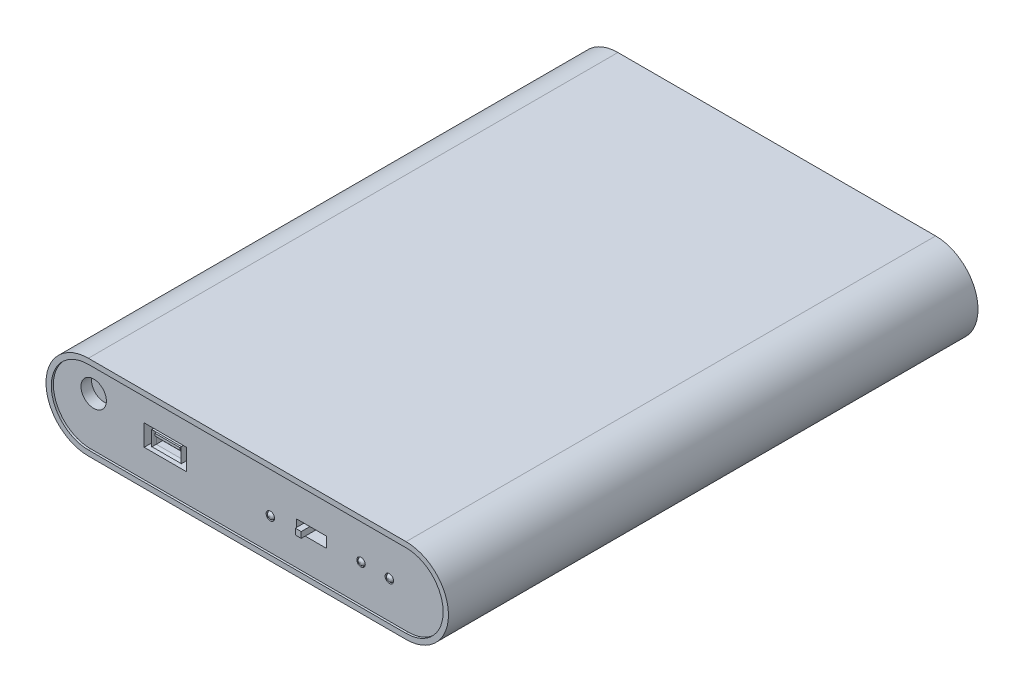
from build123d import *

# Parameters (mm, degrees)
EXTRUDE_1_DEPTH     = 250
SKETCH_2_R          = 4
CUT_EXTRUDE_1_DEPTH = 5
SKETCH_3_R          = 6
SKETCH_3_R_2        = 5.8
CUT_EXTRUDE_2_DEPTH = 5
FILLET_1_R          = 0.5
SKETCH_4_R          = 6
CUT_EXTRUDE_3_DEPTH = 1
CUT_EXTRUDE_START   = -1
CUT_EXTRUDE_4_DEPTH = 1
SKETCH_6_R          = 6
SKETCH_6_R_2        = 2
SKETCH_6_W          = 20
SKETCH_6_H          = 10
SKETCH_6_W_2        = 14
SKETCH_6_H_2        = 5
CUT_EXTRUDE_5_DEPTH = 5
SKETCH_7_R          = 1.8
EXTRUDE_2_DEPTH     = 5.5
FILLET_2_R          = 1.5
SKETCH_8_W          = 2.8
SKETCH_8_H          = 2.8
EXTRUDE_3_DEPTH     = 8
SKETCH_9_W          = 5
SKETCH_9_H          = 2.8
EXTRUDE_4_DEPTH     = 1
SKETCH_10_W         = 14
SKETCH_10_H         = 7
SKETCH_10_W_2       = 12.5
SKETCH_10_H_2       = 5.8
EXTRUDE_5_DEPTH     = 5
FILLET_3_R          = 2
SKETCH_11_W         = 12
SKETCH_11_H         = 1.131040785
EXTRUDE_6_DEPTH     = 4


with BuildPart() as part:
    # 草图1 → 凸台-拉伸1 (new body)
    with BuildSketch(Plane.XY):
        with BuildLine():
            Line((-75, 20), (75, 20))
            ThreePointArc((75, 20), (95, 0), (75, -20))
            Line((75, -20), (-75, -20))
            ThreePointArc((-75, -20), (-95, 0), (-75, 20))
        make_face()
    extrude(amount=EXTRUDE_1_DEPTH)

    # 草图2 → 切除-拉伸1 (cut)
    with BuildSketch(Plane(origin=(0, 0, 0), x_dir=(-1, 0, 0), z_dir=(0, 0, -1))):
        with Locations((24, -8)):
            Circle(SKETCH_2_R)
        with Locations((48, -8)):
            Circle(SKETCH_2_R)
        with Locations((0, -8)):
            Circle(SKETCH_2_R)
        with Locations((-24, -8)):
            Circle(SKETCH_2_R)
        with Locations((-48, -8)):
            Circle(SKETCH_2_R)
        with Locations((-48, 8)):
            Circle(SKETCH_2_R)
        with Locations((-24, 8)):
            Circle(SKETCH_2_R)
        with Locations((0, 8)):
            Circle(SKETCH_2_R)
        with Locations((24, 8)):
            Circle(SKETCH_2_R)
        with Locations((48, 8)):
            Circle(SKETCH_2_R)
    extrude(amount=-CUT_EXTRUDE_1_DEPTH, mode=Mode.SUBTRACT)

    # 草图3 → 切除-拉伸2 (cut)
    # profile 1 of 10: a face of its own
    with BuildSketch(Plane(origin=(0, 0, 0), x_dir=(-1, 0, 0), z_dir=(0, 0, -1))):
        with Locations((-48, -8)):
            Circle(SKETCH_3_R)
        with Locations((-48, -8)):
            Circle(SKETCH_3_R_2, mode=Mode.SUBTRACT)
    # profile 2 of 10: a face of its own
    with BuildSketch(Plane(origin=(0, 0, 0), x_dir=(-1, 0, 0), z_dir=(0, 0, -1))):
        with Locations((-24, -8)):
            Circle(SKETCH_3_R)
        with Locations((-24, -8)):
            Circle(SKETCH_3_R_2, mode=Mode.SUBTRACT)
    # profile 3 of 10: a face of its own
    with BuildSketch(Plane(origin=(0, 0, 0), x_dir=(-1, 0, 0), z_dir=(0, 0, -1))):
        with Locations((24, -8)):
            Circle(SKETCH_3_R)
        with Locations((24, -8)):
            Circle(SKETCH_3_R_2, mode=Mode.SUBTRACT)
    # profile 4 of 10: a face of its own
    with BuildSketch(Plane(origin=(0, 0, 0), x_dir=(-1, 0, 0), z_dir=(0, 0, -1))):
        with Locations((48, -8)):
            Circle(SKETCH_3_R)
        with Locations((48, -8)):
            Circle(SKETCH_3_R_2, mode=Mode.SUBTRACT)
    # profile 5 of 10: a face of its own
    with BuildSketch(Plane(origin=(0, 0, 0), x_dir=(-1, 0, 0), z_dir=(0, 0, -1))):
        with Locations((0, -8)):
            Circle(SKETCH_3_R)
        with Locations((0, -8)):
            Circle(SKETCH_3_R_2, mode=Mode.SUBTRACT)
    # profile 6 of 10: a face of its own
    with BuildSketch(Plane(origin=(0, 0, 0), x_dir=(-1, 0, 0), z_dir=(0, 0, -1))):
        with Locations((-48, 8)):
            Circle(SKETCH_3_R)
        with Locations((-48, 8)):
            Circle(SKETCH_3_R_2, mode=Mode.SUBTRACT)
    # profile 7 of 10: a face of its own
    with BuildSketch(Plane(origin=(0, 0, 0), x_dir=(-1, 0, 0), z_dir=(0, 0, -1))):
        with Locations((-24, 8)):
            Circle(SKETCH_3_R)
        with Locations((-24, 8)):
            Circle(SKETCH_3_R_2, mode=Mode.SUBTRACT)
    # profile 8 of 10: a face of its own
    with BuildSketch(Plane(origin=(0, 0, 0), x_dir=(-1, 0, 0), z_dir=(0, 0, -1))):
        with Locations((0, 8)):
            Circle(SKETCH_3_R)
        with Locations((0, 8)):
            Circle(SKETCH_3_R_2, mode=Mode.SUBTRACT)
    # profile 9 of 10: a face of its own
    with BuildSketch(Plane(origin=(0, 0, 0), x_dir=(-1, 0, 0), z_dir=(0, 0, -1))):
        with Locations((24, 8)):
            Circle(SKETCH_3_R)
        with Locations((24, 8)):
            Circle(SKETCH_3_R_2, mode=Mode.SUBTRACT)
    # profile 10 of 10: a face of its own
    with BuildSketch(Plane(origin=(0, 0, 0), x_dir=(-1, 0, 0), z_dir=(0, 0, -1))):
        with Locations((48, 8)):
            Circle(SKETCH_3_R)
        with Locations((48, 8)):
            Circle(SKETCH_3_R_2, mode=Mode.SUBTRACT)
    extrude(amount=-CUT_EXTRUDE_2_DEPTH, mode=Mode.SUBTRACT)

    # 圆角1
    fillet_1_edges = [part.edges().sort_by_distance(p)[0] for p in [
        (53.8, -8, 0),
        (-44, -8, 0),
        (4, -8, 0),
        (28, -8, 0),
        (52, -8, 0),
        (28, 8, 0),
        (52, 8, 0),
        (4, 8, 0),
        (-20, 8, 0),
        (-44, 8, 0),
        (-20, -8, 0),
        (5.8, -8, 0),
        (-42.2, -8, 0),
        (-18.2, -8, 0),
        (29.8, -8, 0),
        (53.8, 8, 0),
        (29.8, 8, 0),
        (5.8, 8, 0),
        (-18.2, 8, 0),
        (-42.2, 8, 0),
    ]]
    fillet(fillet_1_edges, radius=FILLET_1_R)

    # 草图4 → 切除-拉伸3 (cut)
    with BuildSketch(Plane(origin=(0, 0, 0), x_dir=(-1, 0, 0), z_dir=(0, 0, -1))):
        with BuildLine():
            Line((-75, -17.5), (75, -17.5))
            ThreePointArc((75, -17.5), (92.5, 0), (75, 17.5))
            Line((75, 17.5), (-75, 17.5))
            ThreePointArc((-75, 17.5), (-92.5, 0), (-75, -17.5))
        make_face()
        with Locations((-48, -8)):
            Circle(SKETCH_4_R, mode=Mode.SUBTRACT)
        with Locations((-24, -8)):
            Circle(SKETCH_4_R, mode=Mode.SUBTRACT)
        with Locations((0, -8)):
            Circle(SKETCH_4_R, mode=Mode.SUBTRACT)
        with Locations((48, -8)):
            Circle(SKETCH_4_R, mode=Mode.SUBTRACT)
        with Locations((24, -8)):
            Circle(SKETCH_4_R, mode=Mode.SUBTRACT)
        with Locations((-48, 8)):
            Circle(SKETCH_4_R, mode=Mode.SUBTRACT)
        with Locations((-24, 8)):
            Circle(SKETCH_4_R, mode=Mode.SUBTRACT)
        with Locations((0, 8)):
            Circle(SKETCH_4_R, mode=Mode.SUBTRACT)
        with Locations((24, 8)):
            Circle(SKETCH_4_R, mode=Mode.SUBTRACT)
        with Locations((48, 8)):
            Circle(SKETCH_4_R, mode=Mode.SUBTRACT)
    extrude(amount=-CUT_EXTRUDE_3_DEPTH, mode=Mode.SUBTRACT)

    # 草图5 → 切除-拉伸4 (cut)
    with BuildSketch(Plane.XY.offset(250).offset(CUT_EXTRUDE_START)):
        with BuildLine():
            Line((-75, -17.5), (75, -17.5))
            ThreePointArc((75, -17.5), (92.5, 0), (75, 17.5))
            Line((75, 17.5), (-75, 17.5))
            ThreePointArc((-75, 17.5), (-92.5, 0), (-75, -17.5))
        make_face()
    extrude(amount=CUT_EXTRUDE_4_DEPTH, mode=Mode.SUBTRACT)

    # 草图6 → 切除-拉伸5 (cut)
    with BuildSketch(Plane.XY.offset(249)):
        with Locations((-73.491317321, 5.761646119)):
            Circle(SKETCH_6_R)
        with Locations((52.725353747, -0.03600957)):
            Circle(SKETCH_6_R_2)
        with Locations((66.100916192, -0.03600957)):
            Circle(SKETCH_6_R_2)
        with Locations((9.923553925, -2.53600957)):
            Circle(SKETCH_6_R_2)
        with Locations((-39.658496965, 0.761646119)):
            Rectangle(SKETCH_6_W, SKETCH_6_H)
        with Locations((29.326348191, -0.03600957)):
            Rectangle(SKETCH_6_W_2, SKETCH_6_H_2)
    extrude(amount=-CUT_EXTRUDE_5_DEPTH, mode=Mode.SUBTRACT)

    # 草图7 → 凸台-拉伸2 (add)
    with BuildSketch(Plane.XY.offset(244)):
        with Locations((9.923553925, -2.53600957)):
            Circle(SKETCH_7_R)
        with Locations((52.725353747, -0.03600957)):
            Circle(SKETCH_7_R)
        with Locations((66.100916192, -0.03600957)):
            Circle(SKETCH_7_R)
    extrude(amount=EXTRUDE_2_DEPTH)

    # 圆角2
    fillet_2_edges = [part.edges().sort_by_distance(p)[0] for p in [
        (8.123553925, -2.53600957, 249.5),
        (50.925353747, -0.03600957, 249.5),
        (64.300916192, -0.03600957, 249.5),
    ]]
    fillet(fillet_2_edges, radius=FILLET_2_R)

    # 草图8 → 凸台-拉伸3 (add)
    with BuildSketch(Plane.XY.offset(244)):
        with Locations((26.09607639, -0.015464623)):
            Rectangle(SKETCH_8_W, SKETCH_8_H)
    extrude(amount=EXTRUDE_3_DEPTH)

    # 草图9 → 凸台-拉伸4 (add)
    with BuildSketch(Plane.XY.offset(244)):
        with Locations((29.99607639, -0.015464623)):
            Rectangle(SKETCH_9_W, SKETCH_9_H)
    extrude(amount=EXTRUDE_4_DEPTH)

    # 草图10 → 凸台-拉伸5 (add)
    with BuildSketch(Plane.XY.offset(244)):
        with Locations((-39.658496965, 0.761646119)):
            Rectangle(SKETCH_10_W, SKETCH_10_H)
        with Locations((-39.658496965, 0.761646119)):
            Rectangle(SKETCH_10_W_2, SKETCH_10_H_2, mode=Mode.SUBTRACT)
    extrude(amount=EXTRUDE_5_DEPTH)

    # 圆角3
    # the kernel refuses this fillet: 2 mm, written as the material it takes off along each edge
    with BuildSketch(Plane(origin=(-33.408496965, 3.661646119, 249), x_dir=(1, 0, 0), z_dir=(0, -1, 0)), Plane(origin=(-45.908496965, -2.138353881, 249), x_dir=(-1, 0, 0), z_dir=(0, 1, 0))) as fillet_3_piece_1:
        with BuildLine():
            CenterArc((FILLET_3_R, -FILLET_3_R), FILLET_3_R, 90, 90)
            Line((0, -FILLET_3_R), (-FILLET_3_R * 0.02, -FILLET_3_R))
            Line((-FILLET_3_R * 0.02, -FILLET_3_R), (-FILLET_3_R * 0.02, FILLET_3_R * 0.02))
            Line((-FILLET_3_R * 0.02, FILLET_3_R * 0.02), (FILLET_3_R, FILLET_3_R * 0.02))
            Line((FILLET_3_R, FILLET_3_R * 0.02), (FILLET_3_R, 0))
        make_face()
    extrude(amount=5.8, mode=Mode.SUBTRACT)
    with BuildSketch(Plane(origin=(-33.408496965, -2.138353881, 249), x_dir=(0, -1, 0), z_dir=(-1, 0, 0)), Plane(origin=(-45.908496965, 3.661646119, 249), x_dir=(0, 1, 0), z_dir=(1, 0, 0))) as fillet_3_piece_2:
        with BuildLine():
            CenterArc((FILLET_3_R, -FILLET_3_R), FILLET_3_R, 90, 90)
            Line((0, -FILLET_3_R), (-FILLET_3_R * 0.02, -FILLET_3_R))
            Line((-FILLET_3_R * 0.02, -FILLET_3_R), (-FILLET_3_R * 0.02, FILLET_3_R * 0.02))
            Line((-FILLET_3_R * 0.02, FILLET_3_R * 0.02), (FILLET_3_R, FILLET_3_R * 0.02))
            Line((FILLET_3_R, FILLET_3_R * 0.02), (FILLET_3_R, 0))
        make_face()
    extrude(amount=12.5, mode=Mode.SUBTRACT)
    with BuildSketch(Plane(origin=(-33.408496965, 8.661646119, 249), x_dir=(1, 0, 0), z_dir=(0, -1, 0))) as fillet_3_piece_3a_section:
        with BuildLine():
            CenterArc((FILLET_3_R, -FILLET_3_R), FILLET_3_R, 90, 90)
            Line((0, -FILLET_3_R), (-FILLET_3_R * 0.02, -FILLET_3_R))
            Line((-FILLET_3_R * 0.02, -FILLET_3_R), (-FILLET_3_R * 0.02, FILLET_3_R * 0.02))
            Line((-FILLET_3_R * 0.02, FILLET_3_R * 0.02), (FILLET_3_R, FILLET_3_R * 0.02))
            Line((FILLET_3_R, FILLET_3_R * 0.02), (FILLET_3_R, 0))
        make_face()
    fillet_3_piece_3a = extrude(amount=10.8, mode=Mode.PRIVATE)
    fillet_3_piece_3a = split(fillet_3_piece_3a, bisect_by=Plane(origin=(-32.955706736, 3.661646119, 248.547209771), z_dir=(0, 1, 0)), keep=Keep.TOP, mode=Mode.PRIVATE)
    with BuildSketch(Plane(origin=(-45.908496965, 3.661646119, 249), x_dir=(0, 1, 0), z_dir=(1, 0, 0))) as fillet_3_piece_3b_section:
        with BuildLine():
            CenterArc((FILLET_3_R, -FILLET_3_R), FILLET_3_R, 90, 90)
            Line((0, -FILLET_3_R), (-FILLET_3_R * 0.02, -FILLET_3_R))
            Line((-FILLET_3_R * 0.02, -FILLET_3_R), (-FILLET_3_R * 0.02, FILLET_3_R * 0.02))
            Line((-FILLET_3_R * 0.02, FILLET_3_R * 0.02), (FILLET_3_R, FILLET_3_R * 0.02))
            Line((FILLET_3_R, FILLET_3_R * 0.02), (FILLET_3_R, 0))
        make_face()
    fillet_3_piece_3b = extrude(amount=17.5, mode=Mode.PRIVATE)
    fillet_3_piece_3b = split(fillet_3_piece_3b, bisect_by=Plane(origin=(-33.408496965, 4.114436348, 248.547209771), z_dir=(1, 0, 0)), keep=Keep.TOP, mode=Mode.PRIVATE)
    fillet_3_piece_3 = fillet_3_piece_3a & fillet_3_piece_3b
    add(fillet_3_piece_3, mode=Mode.SUBTRACT)
    with BuildSketch(Plane(origin=(-28.408496965, -2.138353881, 249), x_dir=(0, -1, 0), z_dir=(-1, 0, 0))) as fillet_3_piece_4a_section:
        with BuildLine():
            CenterArc((FILLET_3_R, -FILLET_3_R), FILLET_3_R, 90, 90)
            Line((0, -FILLET_3_R), (-FILLET_3_R * 0.02, -FILLET_3_R))
            Line((-FILLET_3_R * 0.02, -FILLET_3_R), (-FILLET_3_R * 0.02, FILLET_3_R * 0.02))
            Line((-FILLET_3_R * 0.02, FILLET_3_R * 0.02), (FILLET_3_R, FILLET_3_R * 0.02))
            Line((FILLET_3_R, FILLET_3_R * 0.02), (FILLET_3_R, 0))
        make_face()
    fillet_3_piece_4a = extrude(amount=17.5, mode=Mode.PRIVATE)
    fillet_3_piece_4a = split(fillet_3_piece_4a, bisect_by=Plane(origin=(-33.408496965, -2.591144109, 248.547209771), z_dir=(1, 0, 0)), keep=Keep.TOP, mode=Mode.PRIVATE)
    with BuildSketch(Plane(origin=(-33.408496965, 3.661646119, 249), x_dir=(1, 0, 0), z_dir=(0, -1, 0))) as fillet_3_piece_4b_section:
        with BuildLine():
            CenterArc((FILLET_3_R, -FILLET_3_R), FILLET_3_R, 90, 90)
            Line((0, -FILLET_3_R), (-FILLET_3_R * 0.02, -FILLET_3_R))
            Line((-FILLET_3_R * 0.02, -FILLET_3_R), (-FILLET_3_R * 0.02, FILLET_3_R * 0.02))
            Line((-FILLET_3_R * 0.02, FILLET_3_R * 0.02), (FILLET_3_R, FILLET_3_R * 0.02))
            Line((FILLET_3_R, FILLET_3_R * 0.02), (FILLET_3_R, 0))
        make_face()
    fillet_3_piece_4b = extrude(amount=10.8, mode=Mode.PRIVATE)
    fillet_3_piece_4b = split(fillet_3_piece_4b, bisect_by=Plane(origin=(-32.955706736, -2.138353881, 248.547209771), z_dir=(0, -1, 0)), keep=Keep.TOP, mode=Mode.PRIVATE)
    fillet_3_piece_4 = fillet_3_piece_4a & fillet_3_piece_4b
    add(fillet_3_piece_4, mode=Mode.SUBTRACT)
    with BuildSketch(Plane(origin=(-45.908496965, -7.138353881, 249), x_dir=(-1, 0, 0), z_dir=(0, 1, 0))) as fillet_3_piece_5a_section:
        with BuildLine():
            CenterArc((FILLET_3_R, -FILLET_3_R), FILLET_3_R, 90, 90)
            Line((0, -FILLET_3_R), (-FILLET_3_R * 0.02, -FILLET_3_R))
            Line((-FILLET_3_R * 0.02, -FILLET_3_R), (-FILLET_3_R * 0.02, FILLET_3_R * 0.02))
            Line((-FILLET_3_R * 0.02, FILLET_3_R * 0.02), (FILLET_3_R, FILLET_3_R * 0.02))
            Line((FILLET_3_R, FILLET_3_R * 0.02), (FILLET_3_R, 0))
        make_face()
    fillet_3_piece_5a = extrude(amount=10.8, mode=Mode.PRIVATE)
    fillet_3_piece_5a = split(fillet_3_piece_5a, bisect_by=Plane(origin=(-46.361287194, -2.138353881, 248.547209771), z_dir=(0, -1, 0)), keep=Keep.TOP, mode=Mode.PRIVATE)
    with BuildSketch(Plane(origin=(-33.408496965, -2.138353881, 249), x_dir=(0, -1, 0), z_dir=(-1, 0, 0))) as fillet_3_piece_5b_section:
        with BuildLine():
            CenterArc((FILLET_3_R, -FILLET_3_R), FILLET_3_R, 90, 90)
            Line((0, -FILLET_3_R), (-FILLET_3_R * 0.02, -FILLET_3_R))
            Line((-FILLET_3_R * 0.02, -FILLET_3_R), (-FILLET_3_R * 0.02, FILLET_3_R * 0.02))
            Line((-FILLET_3_R * 0.02, FILLET_3_R * 0.02), (FILLET_3_R, FILLET_3_R * 0.02))
            Line((FILLET_3_R, FILLET_3_R * 0.02), (FILLET_3_R, 0))
        make_face()
    fillet_3_piece_5b = extrude(amount=17.5, mode=Mode.PRIVATE)
    fillet_3_piece_5b = split(fillet_3_piece_5b, bisect_by=Plane(origin=(-45.908496965, -2.591144109, 248.547209771), z_dir=(-1, 0, 0)), keep=Keep.TOP, mode=Mode.PRIVATE)
    fillet_3_piece_5 = fillet_3_piece_5a & fillet_3_piece_5b
    add(fillet_3_piece_5, mode=Mode.SUBTRACT)
    with BuildSketch(Plane(origin=(-45.908496965, -2.138353881, 249), x_dir=(-1, 0, 0), z_dir=(0, 1, 0))) as fillet_3_piece_6a_section:
        with BuildLine():
            CenterArc((FILLET_3_R, -FILLET_3_R), FILLET_3_R, 90, 90)
            Line((0, -FILLET_3_R), (-FILLET_3_R * 0.02, -FILLET_3_R))
            Line((-FILLET_3_R * 0.02, -FILLET_3_R), (-FILLET_3_R * 0.02, FILLET_3_R * 0.02))
            Line((-FILLET_3_R * 0.02, FILLET_3_R * 0.02), (FILLET_3_R, FILLET_3_R * 0.02))
            Line((FILLET_3_R, FILLET_3_R * 0.02), (FILLET_3_R, 0))
        make_face()
    fillet_3_piece_6a = extrude(amount=10.8, mode=Mode.PRIVATE)
    fillet_3_piece_6a = split(fillet_3_piece_6a, bisect_by=Plane(origin=(-46.361287194, 3.661646119, 248.547209771), z_dir=(0, 1, 0)), keep=Keep.TOP, mode=Mode.PRIVATE)
    with BuildSketch(Plane(origin=(-50.908496965, 3.661646119, 249), x_dir=(0, 1, 0), z_dir=(1, 0, 0))) as fillet_3_piece_6b_section:
        with BuildLine():
            CenterArc((FILLET_3_R, -FILLET_3_R), FILLET_3_R, 90, 90)
            Line((0, -FILLET_3_R), (-FILLET_3_R * 0.02, -FILLET_3_R))
            Line((-FILLET_3_R * 0.02, -FILLET_3_R), (-FILLET_3_R * 0.02, FILLET_3_R * 0.02))
            Line((-FILLET_3_R * 0.02, FILLET_3_R * 0.02), (FILLET_3_R, FILLET_3_R * 0.02))
            Line((FILLET_3_R, FILLET_3_R * 0.02), (FILLET_3_R, 0))
        make_face()
    fillet_3_piece_6b = extrude(amount=17.5, mode=Mode.PRIVATE)
    fillet_3_piece_6b = split(fillet_3_piece_6b, bisect_by=Plane(origin=(-45.908496965, 4.114436348, 248.547209771), z_dir=(-1, 0, 0)), keep=Keep.TOP, mode=Mode.PRIVATE)
    fillet_3_piece_6 = fillet_3_piece_6a & fillet_3_piece_6b
    add(fillet_3_piece_6, mode=Mode.SUBTRACT)

    # 草图11 → 凸台-拉伸6 (add)
    with BuildSketch(Plane.XY.offset(244)):
        with Locations((-39.658496965, 2.491119886)):
            Rectangle(SKETCH_11_W, SKETCH_11_H)
    extrude(amount=EXTRUDE_6_DEPTH)


solid = part.part
